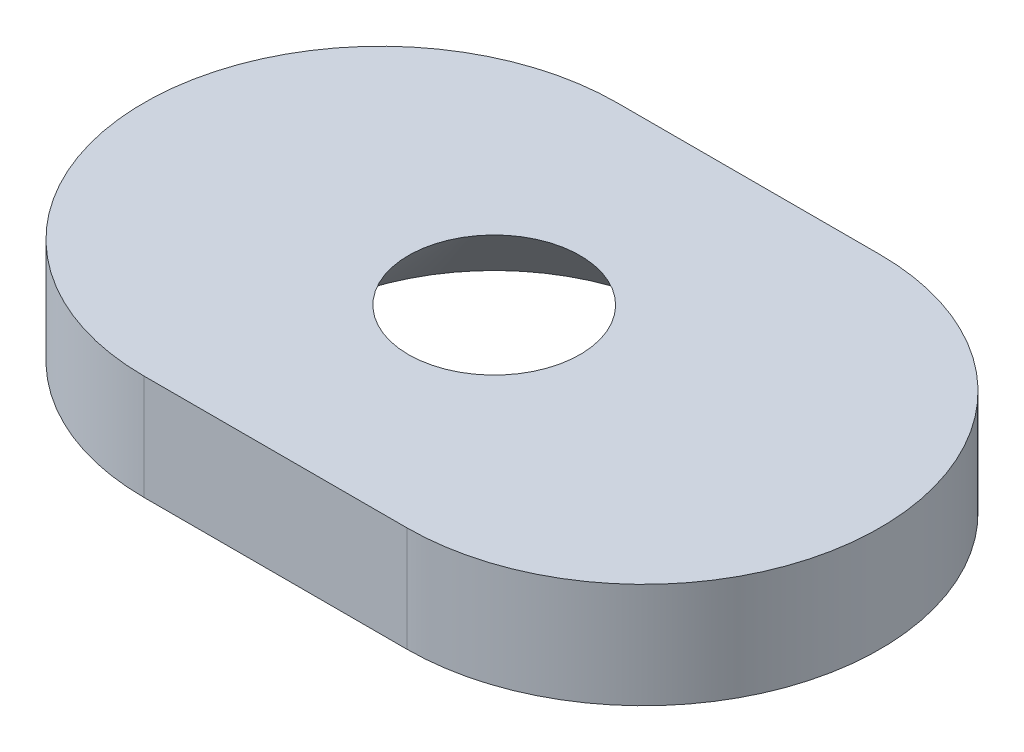
from build123d import *

# Parameters (mm, degrees)
RESSALTO_EXTRUS_O1_DEPTH = 4
ESBO_O3_R                = 3.265
CORTE_EXTRUS_O1_DEPTH    = 10
CHANFRO1_SIZE            = 4


with BuildPart() as part:
    # Esboço2 → Ressalto-extrusão1 (new body)
    with BuildSketch(Plane(origin=(0, 0, 0), x_dir=(1, 0, 0), z_dir=(0, 1, 0))):
        with BuildLine():
            Line((-4.324324324, 9), (5.675675676, 9))
            ThreePointArc((5.675675676, 9), (14.675675676, 0), (5.675675676, -9))
            Line((5.675675676, -9), (-4.324324324, -9))
            ThreePointArc((-4.324324324, -9), (-13.324324324, 0), (-4.324324324, 9))
        make_face()
    extrude(amount=RESSALTO_EXTRUS_O1_DEPTH)

    # Esboço3 → Corte-extrusão1 (cut)
    with BuildSketch(Plane(origin=(0, 0, 0), x_dir=(-1, 0, 0), z_dir=(0, -1, 0))):
        with Locations(Location((0, 0, 0), (0, 0, 90))):
            Circle(ESBO_O3_R)
    extrude(amount=-CORTE_EXTRUS_O1_DEPTH, mode=Mode.SUBTRACT)

    # Chanfro1
    chanfro1_edges = [part.edges().sort_by_distance(p)[0] for p in [
        (0, 0, 3.265),
    ]]
    chamfer(chanfro1_edges, length=CHANFRO1_SIZE - 0.0001)  # a hair under: the kernel refuses the full size


solid = part.part
